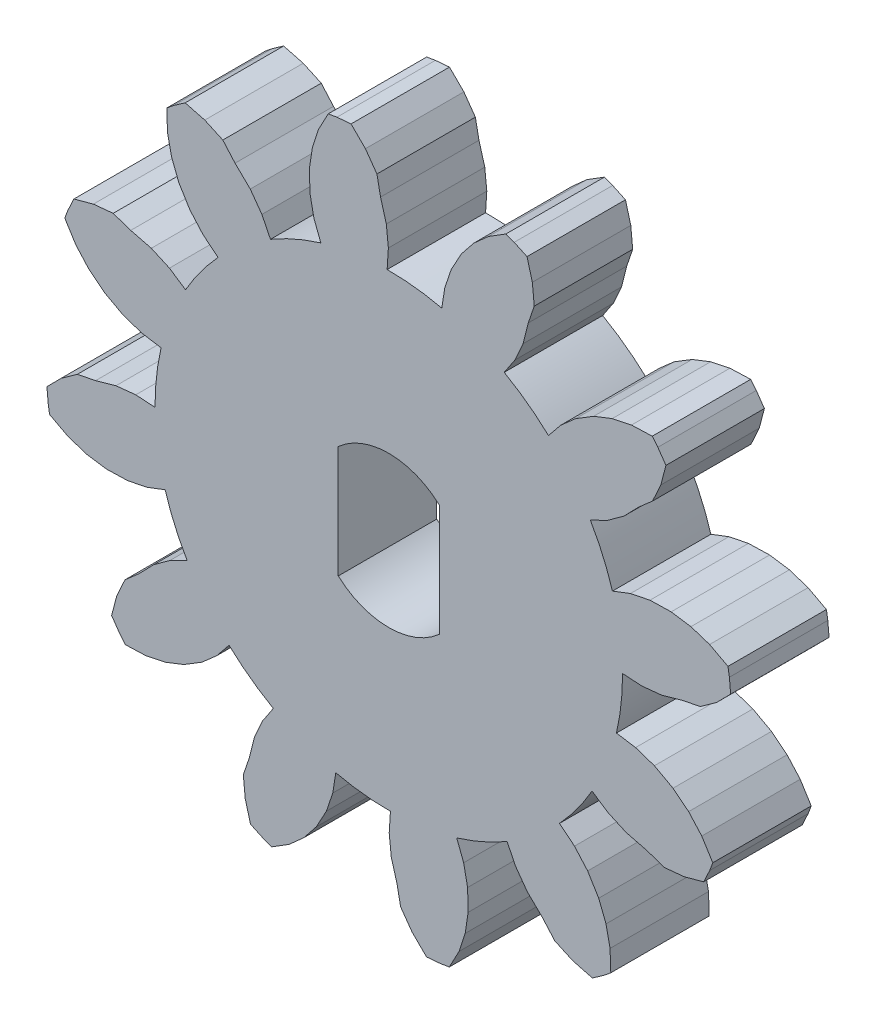
from build123d import *

# Parameters (mm, degrees)
BOSS_EXTRUDE1_DEPTH = 3


with BuildPart() as part:
    # Sketch2 → Boss-Extrude1 (new body)
    with BuildSketch(Plane.XY):
        with BuildLine():
            Line((10.764312003, 2.768963832), (11.314585021, 2.979826852))
            Line((11.314585021, 2.979826852), (11.907905886, 3.099989043))
            Line((11.907905886, 3.099989043), (12.554062339, 3.116630782))
            Line((12.554062339, 3.116630782), (13.15582989, 3.026446478))
            Line((13.15582989, 3.026446478), (13.724935617, 2.839967225))
            Line((13.724935617, 2.839967225), (14.284624243, 2.542841558))
            Line((14.284624243, 2.542841558), (14.328442059, 2.277753344))
            Line((14.328442059, 2.277753344), (14.365462724, 1.848073128))
            Line((14.365462724, 1.848073128), (13.931453723, 1.409980148))
            Line((13.931453723, 1.409980148), (13.438784278, 1.05923704))
            Line((13.438784278, 1.05923704), (12.883922864, 0.949031011))
            Line((12.883922864, 0.949031011), (12.262066151, 0.772709319))
            Line((12.262066151, 0.772709319), (11.659859376, 0.710938766))
            Line((11.659859376, 0.710938766), (11.07177128, 0.748568517))
            ThreePointArc((11.07177128, 0.748568517), (11.028281112, -0.089512253), (10.88653804, -0.916663796))
            Line((10.88653804, -0.916663796), (11.468519963, -1.009187572))
            Line((11.468519963, -1.009187572), (12.042432, -1.201784495))
            Line((12.042432, -1.201784495), (12.610340773, -1.510450553))
            Line((12.610340773, -1.510450553), (13.086394607, -1.889436226))
            Line((13.086394607, -1.889436226), (13.486014998, -2.33548486))
            Line((13.486014998, -2.33548486), (13.822156732, -2.872647549))
            Line((13.822156732, -2.872647549), (13.727559967, -3.124129585))
            Line((13.727559967, -3.124129585), (13.544780695, -3.5147539))
            Line((13.544780695, -3.5147539), (12.949871385, -3.677149049))
            Line((12.949871385, -3.677149049), (12.347835576, -3.734566768))
            Line((12.347835576, -3.734566768), (11.812208481, -3.552577282))
            Line((11.812208481, -3.552577282), (11.185503925, -3.39434799))
            Line((11.185503925, -3.39434799), (10.633092282, -3.146739471))
            Line((10.633092282, -3.146739471), (10.142607927, -2.820107103))
            ThreePointArc((10.142607927, -2.820107103), (9.685903952, -3.524161256), (9.14957508, -4.169623969))
            Line((9.14957508, -4.169623969), (9.607324321, -4.54074287))
            Line((9.607324321, -4.54074287), (10.008048263, -4.994492717))
            Line((10.008048263, -4.994492717), (10.345538658, -5.545759751))
            Line((10.345538658, -5.545759751), (10.568320536, -6.111997889))
            Line((10.568320536, -6.111997889), (10.691377629, -6.698097533))
            Line((10.691377629, -6.698097533), (10.713903566, -7.331364934))
            Line((10.713903566, -7.331364934), (10.506239347, -7.501856383))
            Line((10.506239347, -7.501856383), (10.152635696, -7.748757328))
            Line((10.152635696, -7.748757328), (9.556231545, -7.591940997))
            Line((9.556231545, -7.591940997), (9.006144382, -7.340648296))
            Line((9.006144382, -7.340648296), (8.633272454, -6.915227231))
            Line((8.633272454, -6.915227231), (8.169645033, -6.464844366))
            Line((8.169645033, -6.464844366), (7.815046777, -5.974203277))
            Line((7.815046777, -5.974203277), (7.55359105, -5.446089171))
            ThreePointArc((7.55359105, -5.446089171), (6.806046728, -5.827465966), (6.018840944, -6.118288636))
            Line((6.018840944, -6.118288636), (6.229703964, -6.668561653))
            Line((6.229703964, -6.668561653), (6.349866155, -7.261882518))
            Line((6.349866155, -7.261882518), (6.366507894, -7.908038972))
            Line((6.366507894, -7.908038972), (6.27632359, -8.509806523))
            Line((6.27632359, -8.509806523), (6.089844337, -9.07891225))
            Line((6.089844337, -9.07891225), (5.79271867, -9.638600875))
            Line((5.79271867, -9.638600875), (5.527630456, -9.682418692))
            Line((5.527630456, -9.682418692), (5.09795024, -9.719439356))
            Line((5.09795024, -9.719439356), (4.65985726, -9.285430355))
            Line((4.65985726, -9.285430355), (4.309114152, -8.792760911))
            Line((4.309114152, -8.792760911), (4.198908123, -8.237899496))
            Line((4.198908123, -8.237899496), (4.022586431, -7.616042784))
            Line((4.022586431, -7.616042784), (3.960815877, -7.013836008))
            Line((3.960815877, -7.013836008), (3.998445629, -6.425747912))
            ThreePointArc((3.998445629, -6.425747912), (3.160364858, -6.382257745), (2.333213316, -6.240514673))
            Line((2.333213316, -6.240514673), (2.24068954, -6.822496595))
            Line((2.24068954, -6.822496595), (2.048092617, -7.396408632))
            Line((2.048092617, -7.396408632), (1.739426559, -7.964317405))
            Line((1.739426559, -7.964317405), (1.360440885, -8.44037124))
            Line((1.360440885, -8.44037124), (0.914392252, -8.83999163))
            Line((0.914392252, -8.83999163), (0.377229563, -9.176133364))
            Line((0.377229563, -9.176133364), (0.125747527, -9.0815366))
            Line((0.125747527, -9.0815366), (-0.264876788, -8.898757328))
            Line((-0.264876788, -8.898757328), (-0.427271937, -8.303848017))
            Line((-0.427271937, -8.303848017), (-0.484689656, -7.701812209))
            Line((-0.484689656, -7.701812209), (-0.30270017, -7.166185114))
            Line((-0.30270017, -7.166185114), (-0.144470879, -6.539480557))
            Line((-0.144470879, -6.539480557), (0.103137641, -5.987068915))
            Line((0.103137641, -5.987068915), (0.429770009, -5.49658456))
            ThreePointArc((0.429770009, -5.49658456), (-0.274284144, -5.039880584), (-0.919746857, -4.503551712))
            Line((-0.919746857, -4.503551712), (-1.290865759, -4.961300953))
            Line((-1.290865759, -4.961300953), (-1.744615605, -5.362024896))
            Line((-1.744615605, -5.362024896), (-2.295882639, -5.699515291))
            Line((-2.295882639, -5.699515291), (-2.862120777, -5.922297168))
            Line((-2.862120777, -5.922297168), (-3.448220421, -6.045354261))
            Line((-3.448220421, -6.045354261), (-4.081487822, -6.067880198))
            Line((-4.081487822, -6.067880198), (-4.251979272, -5.860215979))
            Line((-4.251979272, -5.860215979), (-4.498880216, -5.506612328))
            Line((-4.498880216, -5.506612328), (-4.342063885, -4.910208178))
            Line((-4.342063885, -4.910208178), (-4.090771184, -4.360121014))
            Line((-4.090771184, -4.360121014), (-3.665350119, -3.987249086))
            Line((-3.665350119, -3.987249086), (-3.214967254, -3.523621665))
            Line((-3.214967254, -3.523621665), (-2.724326165, -3.169023409))
            Line((-2.724326165, -3.169023409), (-2.196212059, -2.907567682))
            ThreePointArc((-2.196212059, -2.907567682), (-2.577588854, -2.160023361), (-2.868411524, -1.372817576))
            Line((-2.868411524, -1.372817576), (-3.418684541, -1.583680597))
            Line((-3.418684541, -1.583680597), (-4.012005406, -1.703842787))
            Line((-4.012005406, -1.703842787), (-4.65816186, -1.720484526))
            Line((-4.65816186, -1.720484526), (-5.259929411, -1.630300222))
            Line((-5.259929411, -1.630300222), (-5.829035138, -1.44382097))
            Line((-5.829035138, -1.44382097), (-6.388723763, -1.146695302))
            Line((-6.388723763, -1.146695302), (-6.43254158, -0.881607088))
            Line((-6.43254158, -0.881607088), (-6.469562245, -0.451926872))
            Line((-6.469562245, -0.451926872), (-6.035553243, -0.013833892))
            Line((-6.035553243, -0.013833892), (-5.542883799, 0.336909216))
            Line((-5.542883799, 0.336909216), (-4.988022384, 0.447115245))
            Line((-4.988022384, 0.447115245), (-4.366165672, 0.623436937))
            Line((-4.366165672, 0.623436937), (-3.763958897, 0.68520749))
            Line((-3.763958897, 0.68520749), (-3.175870801, 0.647577739))
            ThreePointArc((-3.175870801, 0.647577739), (-3.132380633, 1.485658509), (-2.990637561, 2.312810051))
            Line((-2.990637561, 2.312810051), (-3.572619483, 2.405333828))
            Line((-3.572619483, 2.405333828), (-4.146531521, 2.597930751))
            Line((-4.146531521, 2.597930751), (-4.714440293, 2.906596809))
            Line((-4.714440293, 2.906596809), (-5.190494128, 3.285582482))
            Line((-5.190494128, 3.285582482), (-5.590114518, 3.731631116))
            Line((-5.590114518, 3.731631116), (-5.926256252, 4.268793805))
            Line((-5.926256252, 4.268793805), (-5.831659488, 4.52027584))
            Line((-5.831659488, 4.52027584), (-5.648880216, 4.910900156))
            Line((-5.648880216, 4.910900156), (-5.053970905, 5.073295305))
            Line((-5.053970905, 5.073295305), (-4.451935097, 5.130713024))
            Line((-4.451935097, 5.130713024), (-3.916308002, 4.948723538))
            Line((-3.916308002, 4.948723538), (-3.289603445, 4.790494246))
            Line((-3.289603445, 4.790494246), (-2.737191803, 4.542885727))
            Line((-2.737191803, 4.542885727), (-2.246707448, 4.216253359))
            ThreePointArc((-2.246707448, 4.216253359), (-1.790003473, 4.920307512), (-1.2536746, 5.565770224))
            Line((-1.2536746, 5.565770224), (-1.711423841, 5.936889126))
            Line((-1.711423841, 5.936889126), (-2.112147784, 6.390638973))
            Line((-2.112147784, 6.390638973), (-2.449638179, 6.941906007))
            Line((-2.449638179, 6.941906007), (-2.672420056, 7.508144145))
            Line((-2.672420056, 7.508144145), (-2.79547715, 8.094243789))
            Line((-2.79547715, 8.094243789), (-2.818003086, 8.72751119))
            Line((-2.818003086, 8.72751119), (-2.610338867, 8.898002639))
            Line((-2.610338867, 8.898002639), (-2.256735217, 9.144903584))
            Line((-2.256735217, 9.144903584), (-1.660331066, 8.988087253))
            Line((-1.660331066, 8.988087253), (-1.110243903, 8.736794552))
            Line((-1.110243903, 8.736794552), (-0.737371974, 8.311373486))
            Line((-0.737371974, 8.311373486), (-0.273744554, 7.860990622))
            Line((-0.273744554, 7.860990622), (0.080853702, 7.370349533))
            Line((0.080853702, 7.370349533), (0.34230943, 6.842235426))
            ThreePointArc((0.34230943, 6.842235426), (1.089853751, 7.223612222), (1.877059536, 7.514434891))
            Line((1.877059536, 7.514434891), (1.666196515, 8.064707909))
            Line((1.666196515, 8.064707909), (1.546034324, 8.658028774))
            Line((1.546034324, 8.658028774), (1.529392586, 9.304185228))
            Line((1.529392586, 9.304185228), (1.619576889, 9.905952778))
            Line((1.619576889, 9.905952778), (1.806056142, 10.475058505))
            Line((1.806056142, 10.475058505), (2.10318181, 11.034747131))
            Line((2.10318181, 11.034747131), (2.368270023, 11.078564947))
            Line((2.368270023, 11.078564947), (2.79795024, 11.115585612))
            Line((2.79795024, 11.115585612), (3.23604322, 10.681576611))
            Line((3.23604322, 10.681576611), (3.586786327, 10.188907166))
            Line((3.586786327, 10.188907166), (3.696992357, 9.634045752))
            Line((3.696992357, 9.634045752), (3.873314049, 9.01218904))
            Line((3.873314049, 9.01218904), (3.935084602, 8.409982264))
            Line((3.935084602, 8.409982264), (3.897454851, 7.821894168))
            ThreePointArc((3.897454851, 7.821894168), (4.735535621, 7.778404001), (5.562687163, 7.636660929))
            Line((5.562687163, 7.636660929), (5.65521094, 8.218642851))
            Line((5.65521094, 8.218642851), (5.847807863, 8.792554888))
            Line((5.847807863, 8.792554888), (6.156473921, 9.360463661))
            Line((6.156473921, 9.360463661), (6.535459594, 9.836517495))
            Line((6.535459594, 9.836517495), (6.981508228, 10.236137886))
            Line((6.981508228, 10.236137886), (7.518670917, 10.57227962))
            Line((7.518670917, 10.57227962), (7.770152952, 10.477682856))
            Line((7.770152952, 10.477682856), (8.160777268, 10.294903584))
            Line((8.160777268, 10.294903584), (8.323172417, 9.699994273))
            Line((8.323172417, 9.699994273), (8.380590136, 9.097958465))
            Line((8.380590136, 9.097958465), (8.19860065, 8.562331369))
            Line((8.19860065, 8.562331369), (8.040371358, 7.935626813))
            Line((8.040371358, 7.935626813), (7.792762839, 7.383215171))
            Line((7.792762839, 7.383215171), (7.46613047, 6.892730815))
            ThreePointArc((7.46613047, 6.892730815), (8.170184624, 6.43602684), (8.815647336, 5.899697968))
            Line((8.815647336, 5.899697968), (9.186766238, 6.357447209))
            Line((9.186766238, 6.357447209), (9.640516085, 6.758171151))
            Line((9.640516085, 6.758171151), (10.191783119, 7.095661547))
            Line((10.191783119, 7.095661547), (10.758021257, 7.318443424))
            Line((10.758021257, 7.318443424), (11.3441209, 7.441500517))
            Line((11.3441209, 7.441500517), (11.977388302, 7.464026454))
            Line((11.977388302, 7.464026454), (12.147879751, 7.256362235))
            Line((12.147879751, 7.256362235), (12.394780695, 6.902758584))
            Line((12.394780695, 6.902758584), (12.237964365, 6.306354434))
            Line((12.237964365, 6.306354434), (11.986671664, 5.75626727))
            Line((11.986671664, 5.75626727), (11.561250598, 5.383395342))
            Line((11.561250598, 5.383395342), (11.110867734, 4.919767921))
            Line((11.110867734, 4.919767921), (10.620226645, 4.565169665))
            Line((10.620226645, 4.565169665), (10.092112538, 4.303713938))
            ThreePointArc((10.092112538, 4.303713938), (10.473489333, 3.556169616), (10.764312003, 2.768963832))
        make_face()
        with BuildLine():
            Line((2.40795024, -1.010259392), (2.40795024, 2.406405648))
            ThreePointArc((2.40795024, 2.406405648), (3.94795024, 2.998073128), (5.48795024, 2.406405648))
            Line((5.48795024, 2.406405648), (5.48795024, -1.010259392))
            ThreePointArc((5.48795024, -1.010259392), (3.94795024, -1.601926872), (2.40795024, -1.010259392))
        make_face(mode=Mode.SUBTRACT)
    extrude(amount=BOSS_EXTRUDE1_DEPTH)


solid = part.part
